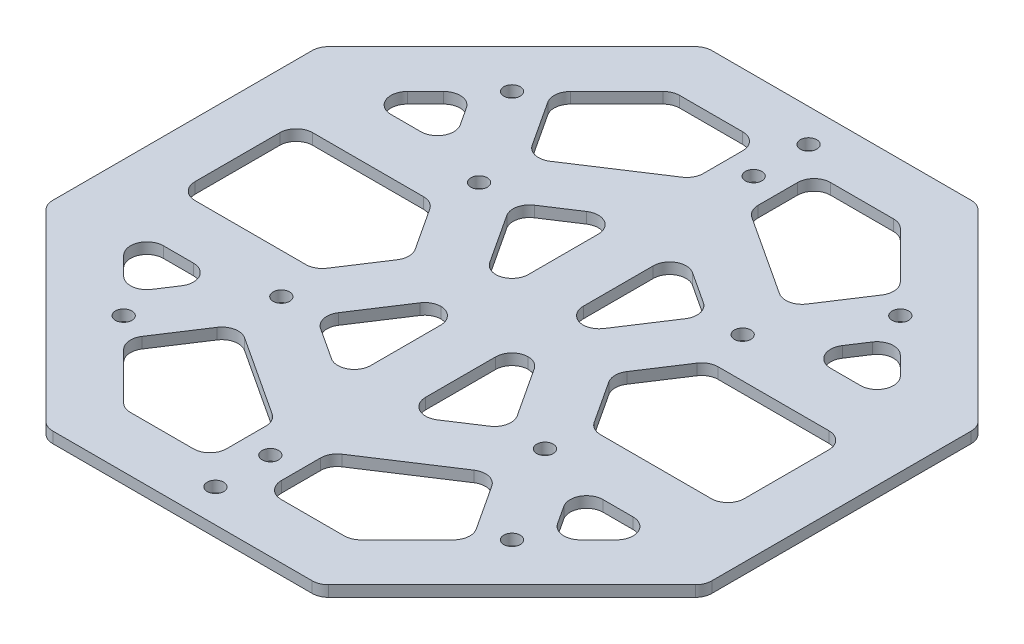
from build123d import *

# Parameters (mm, degrees)
SKETCH_1_R          = 1.5
EXTRUDE_1_DEPTH     = 2
FILLET_1_R          = 3
CUT_EXTRUDE_1_DEPTH = 10
FILLET_2_R          = 3


with BuildPart() as part:
    # 草图1 → 凸台-拉伸1 (new body)
    with BuildSketch(Plane(origin=(0, 0, 0), x_dir=(1, 0, 0), z_dir=(0, 1, 0))):
        Polygon((-24.852813742, 60), (24.852813742, 60), (60, 24.852813742), (60, -24.852813742), (24.852813742, -60), (-24.852813742, -60), (-60, -24.852813742), (-60, 24.852813742), align=None)
        with Locations(Location((-24, 18, 0), (0, 0, 270))):
            Circle(SKETCH_1_R, mode=Mode.SUBTRACT)
        with Locations(Location((24, 18, 0), (0, 0, 270))):
            Circle(SKETCH_1_R, mode=Mode.SUBTRACT)
        with Locations(Location((24, -18, 0), (0, 0, 270))):
            Circle(SKETCH_1_R, mode=Mode.SUBTRACT)
        with Locations(Location((-24, -18, 0), (0, 0, 270))):
            Circle(SKETCH_1_R, mode=Mode.SUBTRACT)
        with Locations(Location((35.355339059, 35.355339059, 0), (0, 0, 270))):
            Circle(SKETCH_1_R, mode=Mode.SUBTRACT)
        with Locations(Location((35.355339059, -35.355339059, 0), (0, 0, 270))):
            Circle(SKETCH_1_R, mode=Mode.SUBTRACT)
        with Locations(Location((-35.355339059, -35.355339059, 0), (0, 0, 270))):
            Circle(SKETCH_1_R, mode=Mode.SUBTRACT)
        with Locations(Location((-35.355339059, 35.355339059, 0), (0, 0, 270))):
            Circle(SKETCH_1_R, mode=Mode.SUBTRACT)
        with Locations(Location((0, 54, 0), (0, 0, 270))):
            Circle(SKETCH_1_R, mode=Mode.SUBTRACT)
        with Locations(Location((0, 44, 0), (0, 0, 270))):
            Circle(SKETCH_1_R, mode=Mode.SUBTRACT)
        with Locations(Location((0, -44, 0), (0, 0, 270))):
            Circle(SKETCH_1_R, mode=Mode.SUBTRACT)
        with Locations(Location((0, -54, 0), (0, 0, 270))):
            Circle(SKETCH_1_R, mode=Mode.SUBTRACT)
    extrude(amount=EXTRUDE_1_DEPTH)

    # 圆角1
    fillet_1_edges = [part.edges().sort_by_distance(p)[0] for p in [
        (-24.852813742, 1, -60),
        (24.852813742, 1, -60),
        (60, 1, -24.852813742),
        (60, 1, 24.852813742),
        (24.852813742, 1, 60),
        (-24.852813742, 1, 60),
        (-60, 1, 24.852813742),
        (-60, 1, -24.852813742),
    ]]
    fillet(fillet_1_edges, radius=FILLET_1_R)

    # 草图2 → 切除-拉伸1 (cut)
    with BuildSketch(Plane.XZ):
        Polygon((-50, 20.710678119), (-38.967252089, 31.743426029), (-31.74868996, 20.710678119), align=None)
        Polygon((-50, 10.710678119), (-25.205839359, 10.710678119), (-18.198002682, 0), (-25.205839359, -10.710678119), (-50, -10.710678119), align=None)
        Polygon((-20.710678119, 50), (-31.743426029, 38.967252089), (-23.38067646, 26.185744334), (-5, 38.211946336), (-5, 50), align=None)
        Polygon((-17.905610244, 17.817730834), (-9.519160455, 5), (-5, 5), (-5, 26.261678808), align=None)
        Polygon((-5, -26.261678808), (-17.905610244, -17.817730834), (-9.519160455, -5), (-5, -5), align=None)
        Polygon((-31.743426029, -38.967252089), (-23.38067646, -26.185744334), (-5, -38.211946336), (-5, -50), (-20.710678119, -50), align=None)
        Polygon((-31.74868996, -20.710678119), (-50, -20.710678119), (-38.967252089, -31.743426029), align=None)
        Polygon((50, -20.710678119), (38.967252089, -31.743426029), (31.74868996, -20.710678119), align=None)
        Polygon((50, -10.710678119), (25.205839359, -10.710678119), (18.198002682, 0), (25.205839359, 10.710678119), (50, 10.710678119), align=None)
        Polygon((20.710678119, -50), (31.743426029, -38.967252089), (23.38067646, -26.185744334), (5, -38.211946336), (5, -50), align=None)
        Polygon((17.905610244, -17.817730834), (9.519160455, -5), (5, -5), (5, -26.261678808), align=None)
        Polygon((5, 26.261678808), (17.905610244, 17.817730834), (9.519160455, 5), (5, 5), align=None)
        Polygon((31.743426029, 38.967252089), (23.38067646, 26.185744334), (5, 38.211946336), (5, 50), (20.710678119, 50), align=None)
        Polygon((31.74868996, 20.710678119), (50, 20.710678119), (38.967252089, 31.743426029), align=None)
    extrude(amount=-CUT_EXTRUDE_1_DEPTH, mode=Mode.SUBTRACT)

    # 圆角2
    # the kernel refuses this fillet: 3 mm, written as the material it adds along each edge
    with BuildSketch(Plane(origin=(-50, 0, 20.710678119), x_dir=(1, 0, 0), z_dir=(0, 1, 0)), Plane(origin=(50, 0, -20.710678119), x_dir=(-1, 0, 0), z_dir=(0, 1, 0))) as fillet_2_piece_1:
        with BuildLine():
            CenterArc((FILLET_2_R * 2.41421356237, -FILLET_2_R), FILLET_2_R, 90, 135)
            Line((FILLET_2_R * 1.70710678119, -FILLET_2_R * 1.70710678119), (0, 0))
            Line((0, 0), (FILLET_2_R * 2.41421356237, 0))
        make_face()
    extrude(amount=2)
    with BuildSketch(Plane(origin=(-38.967252089, 0, 31.743426029), x_dir=(0.5475066215623489, 0, -0.8368013499901772), z_dir=(0, 1, 0)), Plane(origin=(38.967252089, 0, 31.743426029), x_dir=(0.7071067811865509, 0, -0.7071067811865441), z_dir=(0, 1, 0)), Plane(origin=(-38.967252089, 0, -31.743426029), x_dir=(-0.7071067811865476, 0, 0.7071067811865476), z_dir=(0, 1, 0)), Plane(origin=(38.967252089, 0, -31.743426029), x_dir=(-0.5475066215623532, 0, 0.8368013499901743), z_dir=(0, 1, 0))) as fillet_2_piece_2:
        with BuildLine():
            CenterArc((FILLET_2_R * 1.23058475846, FILLET_2_R), FILLET_2_R, 168.196124381, 101.803875619)
            Line((FILLET_2_R * 0.25173120452, FILLET_2_R * 1.20456226423), (0, 0))
            Line((0, 0), (FILLET_2_R * 1.23058475846, 0))
        make_face()
    extrude(amount=2)
    with BuildSketch(Plane(origin=(-31.74868996, 0, 20.710678119), x_dir=(-1, 0, 0), z_dir=(0, 1, 0)), Plane(origin=(5, 0, -26.261678808), x_dir=(0, 0, 1), z_dir=(0, 1, 0)), Plane(origin=(-5, 0, 26.261678808), x_dir=(0, 0, -1), z_dir=(0, 1, 0)), Plane(origin=(31.74868996, 0, -20.710678119), x_dir=(1, 0, 0), z_dir=(0, 1, 0))) as fillet_2_piece_3:
        with BuildLine():
            CenterArc((FILLET_2_R * 1.84931181287, FILLET_2_R), FILLET_2_R, 146.803875619, 123.196124381)
            Line((FILLET_2_R * 1.01251046288, FILLET_2_R * 1.54750662156), (0, 0))
            Line((0, 0), (FILLET_2_R * 1.84931181287, 0))
        make_face()
    extrude(amount=2)
    with BuildSketch(Plane(origin=(5, 0, 38.211946336), x_dir=(0, 0, 1), z_dir=(0, 1, 0)), Plane(origin=(25.205839359, 0, 10.710678119), x_dir=(1, 0, 0), z_dir=(0, 1, 0)), Plane(origin=(25.205839359, 0, -10.710678119), x_dir=(-0.547506621562352, 0, 0.8368013499901751), z_dir=(0, 1, 0)), Plane(origin=(9.519160455, 0, -5), x_dir=(0.5475066215623522, 0, -0.836801349990175), z_dir=(0, 1, 0)), Plane(origin=(9.519160455, 0, 5), x_dir=(-1, 0, 0), z_dir=(0, 1, 0)), Plane(origin=(-5, 0, 38.211946336), x_dir=(-0.8368013499901774, 0, -0.5475066215623484), z_dir=(0, 1, 0)), Plane(origin=(-9.519160455, 0, 5), x_dir=(-0.5475066215623484, 0, 0.8368013499901775), z_dir=(0, 1, 0)), Plane(origin=(-25.205839359, 0, 10.710678119), x_dir=(0.5475066215623494, 0, -0.8368013499901769), z_dir=(0, 1, 0)), Plane(origin=(-25.205839359, 0, -10.710678119), x_dir=(-1, 0, 0), z_dir=(0, 1, 0)), Plane(origin=(-9.519160455, 0, -5), x_dir=(1, 0, 0), z_dir=(0, 1, 0)), Plane(origin=(-5, 0, -38.211946336), x_dir=(0, 0, -1), z_dir=(0, 1, 0)), Plane(origin=(5, 0, -38.211946336), x_dir=(0.8368013499901755, 0, 0.5475066215623515), z_dir=(0, 1, 0))) as fillet_2_piece_4:
        with BuildLine():
            CenterArc((FILLET_2_R * 0.540741692688, FILLET_2_R), FILLET_2_R, 213.196124381, 56.803875619)
            Line((-FILLET_2_R * 0.296059657302, FILLET_2_R * 0.452493378438), (0, 0))
            Line((0, 0), (FILLET_2_R * 0.540741692688, 0))
        make_face()
    extrude(amount=2)
    with BuildSketch(Plane(origin=(5, 0, 50), x_dir=(1, 0, 0), z_dir=(0, 1, 0)), Plane(origin=(23.38067646, 0, 26.185744334), x_dir=(-0.8368013499901791, 0, 0.5475066215623458), z_dir=(0, 1, 0)), Plane(origin=(50, 0, 10.710678119), x_dir=(0, 0, -1), z_dir=(0, 1, 0)), Plane(origin=(5, 0, -5), x_dir=(1, 0, 0), z_dir=(0, 1, 0)), Plane(origin=(17.905610244, 0, 17.817730834), x_dir=(-0.5475066215623455, 0, -0.8368013499901794), z_dir=(0, 1, 0)), Plane(origin=(5, 0, 5), x_dir=(0, 0, 1), z_dir=(0, 1, 0)), Plane(origin=(-5, 0, 50), x_dir=(0, 0, -1), z_dir=(0, 1, 0)), Plane(origin=(-23.38067646, 0, 26.185744334), x_dir=(-0.5475066215623485, 0, 0.8368013499901773), z_dir=(0, 1, 0)), Plane(origin=(-5, 0, 5), x_dir=(-1, 0, 0), z_dir=(0, 1, 0)), Plane(origin=(-50, 0, -10.710678119), x_dir=(0, 0, 1), z_dir=(0, 1, 0)), Plane(origin=(-17.905610244, 0, -17.817730834), x_dir=(0.5475066215623485, 0, 0.8368013499901773), z_dir=(0, 1, 0)), Plane(origin=(-5, 0, -5), x_dir=(0, 0, -1), z_dir=(0, 1, 0)), Plane(origin=(-5, 0, -50), x_dir=(-1, 0, 0), z_dir=(0, 1, 0)), Plane(origin=(-23.38067646, 0, -26.185744334), x_dir=(0.8368013499901773, 0, -0.5475066215623485), z_dir=(0, 1, 0)), Plane(origin=(5, 0, -50), x_dir=(0, 0, 1), z_dir=(0, 1, 0)), Plane(origin=(23.38067646, 0, -26.185744334), x_dir=(0.5475066215623524, 0, -0.8368013499901747), z_dir=(0, 1, 0))) as fillet_2_piece_5:
        with BuildLine():
            CenterArc((FILLET_2_R, FILLET_2_R), FILLET_2_R, 180, 90)
            Line((0, FILLET_2_R), (0, 0))
            Line((0, 0), (FILLET_2_R, 0))
        make_face()
    extrude(amount=2)
    with BuildSketch(Plane(origin=(31.743426029, 0, 38.967252089), x_dir=(-0.7071067811865512, 0, 0.7071067811865439), z_dir=(0, 1, 0)), Plane(origin=(-31.743426029, 0, -38.967252089), x_dir=(0.7071067811865476, 0, -0.7071067811865476), z_dir=(0, 1, 0))) as fillet_2_piece_6:
        with BuildLine():
            CenterArc((FILLET_2_R * 0.812621798807, -FILLET_2_R), FILLET_2_R, 90, 78.196124381)
            Line((-FILLET_2_R * 0.166231755129, -FILLET_2_R * 0.795437735767), (0, 0))
            Line((0, 0), (FILLET_2_R * 0.812621798807, 0))
        make_face()
    extrude(amount=2)
    with BuildSketch(Plane(origin=(50, 0, 20.710678119), x_dir=(-1, 0, 0), z_dir=(0, 1, 0)), Plane(origin=(-50, 0, -20.710678119), x_dir=(1, 0, 0), z_dir=(0, 1, 0))) as fillet_2_piece_7:
        with BuildLine():
            CenterArc((FILLET_2_R * 2.41421356237, FILLET_2_R), FILLET_2_R, 135, 135)
            Line((FILLET_2_R * 1.70710678119, FILLET_2_R * 1.70710678119), (0, 0))
            Line((0, 0), (FILLET_2_R * 2.41421356237, 0))
        make_face()
    extrude(amount=2)
    with BuildSketch(Plane(origin=(31.74868996, 0, 20.710678119), x_dir=(1, 0, 0), z_dir=(0, 1, 0)), Plane(origin=(5, 0, 26.261678808), x_dir=(0, 0, -1), z_dir=(0, 1, 0)), Plane(origin=(-31.74868996, 0, -20.710678119), x_dir=(-1, 0, 0), z_dir=(0, 1, 0)), Plane(origin=(-5, 0, -26.261678808), x_dir=(0, 0, 1), z_dir=(0, 1, 0))) as fillet_2_piece_8:
        with BuildLine():
            CenterArc((FILLET_2_R * 1.84931181287, -FILLET_2_R), FILLET_2_R, 90, 123.196124381)
            Line((FILLET_2_R * 1.01251046288, -FILLET_2_R * 1.54750662156), (0, 0))
            Line((0, 0), (FILLET_2_R * 1.84931181287, 0))
        make_face()
    extrude(amount=2)
    with BuildSketch(Plane(origin=(50, 0, -10.710678119), x_dir=(0, 0, 1), z_dir=(0, 1, 0)), Plane(origin=(17.905610244, 0, -17.817730834), x_dir=(-0.5475066215623521, 0, 0.836801349990175), z_dir=(0, 1, 0)), Plane(origin=(-17.905610244, 0, 17.817730834), x_dir=(0.5475066215623485, 0, -0.8368013499901773), z_dir=(0, 1, 0)), Plane(origin=(-50, 0, 10.710678119), x_dir=(0, 0, -1), z_dir=(0, 1, 0))) as fillet_2_piece_9:
        with BuildLine():
            CenterArc((FILLET_2_R, -FILLET_2_R), FILLET_2_R, 90, 90)
            Line((0, -FILLET_2_R), (0, 0))
            Line((0, 0), (FILLET_2_R, 0))
        make_face()
    extrude(amount=2)
    with BuildSketch(Plane(origin=(18.198002682, 0, 0), x_dir=(0.5475066215623458, 0, 0.8368013499901792), z_dir=(0, 1, 0)), Plane(origin=(-18.198002682, 0, 0), x_dir=(-0.5475066215623492, 0, -0.836801349990177), z_dir=(0, 1, 0))) as fillet_2_piece_10:
        with BuildLine():
            CenterArc((FILLET_2_R * 0.654285060091, FILLET_2_R), FILLET_2_R, 203.607751239, 66.392248761)
            Line((-FILLET_2_R * 0.262023500013, FILLET_2_R * 0.599527001309), (0, 0))
            Line((0, 0), (FILLET_2_R * 0.654285060091, 0))
        make_face()
    extrude(amount=2)
    with BuildSketch(Plane(origin=(-31.743426029, 0, 38.967252089), x_dir=(0.7071067811865476, 0, 0.7071067811865476), z_dir=(0, 1, 0)), Plane(origin=(31.743426029, 0, -38.967252089), x_dir=(-0.7071067811865454, 0, -0.7071067811865497), z_dir=(0, 1, 0))) as fillet_2_piece_11:
        with BuildLine():
            CenterArc((FILLET_2_R * 0.812621798807, FILLET_2_R), FILLET_2_R, 191.803875619, 78.196124381)
            Line((-FILLET_2_R * 0.166231755129, FILLET_2_R * 0.795437735767), (0, 0))
            Line((0, 0), (FILLET_2_R * 0.812621798807, 0))
        make_face()
    extrude(amount=2)
    with BuildSketch(Plane(origin=(-20.710678119, 0, 50), x_dir=(-0.7071067811865476, 0, -0.7071067811865476), z_dir=(0, 1, 0)), Plane(origin=(20.710678119, 0, -50), x_dir=(0.7071067811865446, 0, 0.7071067811865503), z_dir=(0, 1, 0))) as fillet_2_piece_12:
        with BuildLine():
            CenterArc((FILLET_2_R * 0.414213562373, -FILLET_2_R), FILLET_2_R, 90, 45)
            Line((-FILLET_2_R * 0.292893218813, -FILLET_2_R * 0.292893218813), (0, 0))
            Line((0, 0), (FILLET_2_R * 0.414213562373, 0))
        make_face()
    extrude(amount=2)
    with BuildSketch(Plane(origin=(-20.710678119, 0, -50), x_dir=(-0.7071067811865476, 0, 0.7071067811865476), z_dir=(0, 1, 0)), Plane(origin=(20.710678119, 0, 50), x_dir=(0.7071067811865503, 0, -0.7071067811865446), z_dir=(0, 1, 0))) as fillet_2_piece_13:
        with BuildLine():
            CenterArc((FILLET_2_R * 0.414213562373, FILLET_2_R), FILLET_2_R, 225, 45)
            Line((-FILLET_2_R * 0.292893218813, FILLET_2_R * 0.292893218813), (0, 0))
            Line((0, 0), (FILLET_2_R * 0.414213562373, 0))
        make_face()
    extrude(amount=2)


solid = part.part
